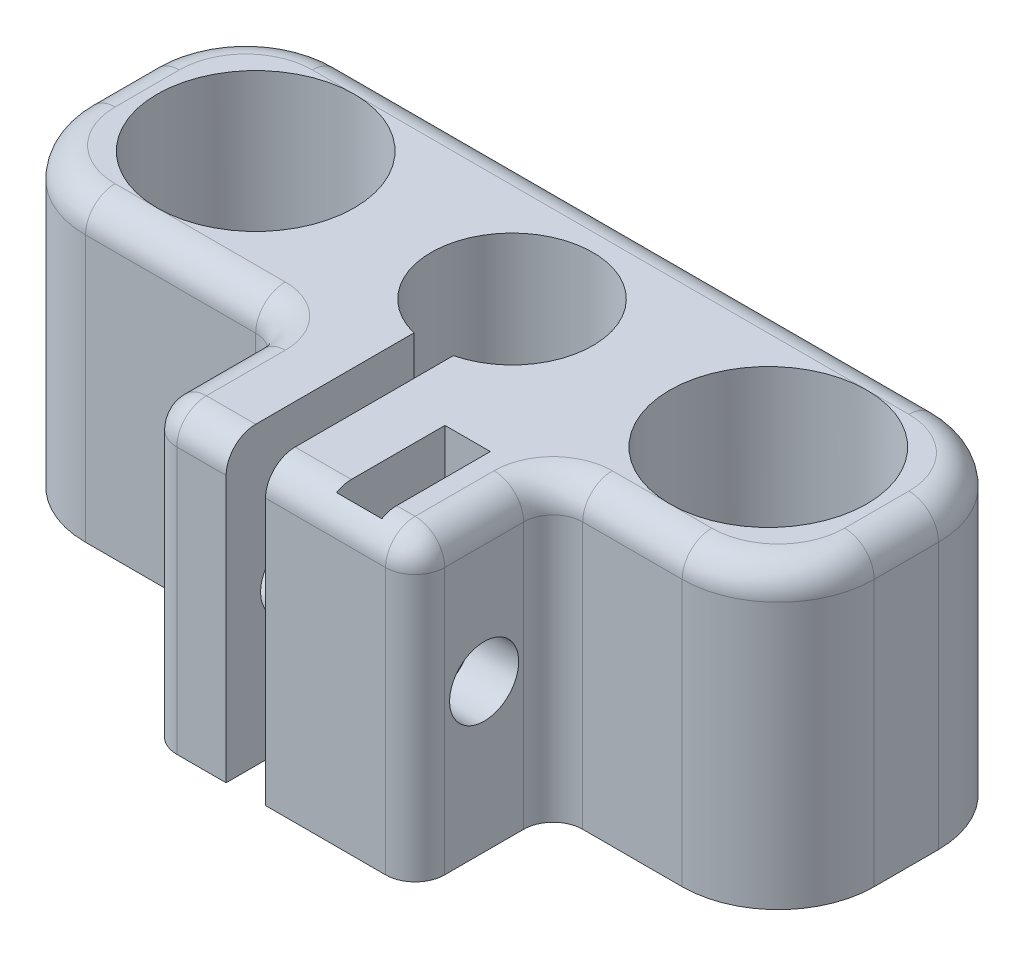
from build123d import *

# Parameters (mm, degrees)
SKETCH1_W               = 2.3
SKETCH1_H               = 5.5
SKETCH1_R               = 2.25
BOSS_EXTRUDE1_DEPTH     = 15
CUT_EXTRUDE1_DEPTH      = 33.128647653
CUT_EXTRUDE1_DEPTH_BACK = 33.128647653
SKETCH2_R               = 1.75
FILLET2_R               = 1.5
SKETCH4_R               = 5
CUT_EXTRUDE2_DEPTH      = 10


with BuildPart() as part:
    # Sketch1 → Boss-Extrude1 (new body)
    with BuildSketch(Plane(origin=(0, 0, 0), x_dir=(1, 0, 0), z_dir=(0, 1, 0))):
        with BuildLine():
            Line((15.13, 6.5), (-15.13, 6.5))
            ThreePointArc((-15.13, 6.5), (-18.573610024, 5.073610024), (-20, 1.63))
            Line((-20, 1.63), (-20, -1.63))
            ThreePointArc((-20, -1.63), (-18.573610024, -5.073610024), (-15.13, -6.5))
            Line((-15.13, -6.5), (-6.5, -6.5))
            ThreePointArc((-6.5, -6.5), (-5.439339828, -6.939339828), (-5, -8))
            Line((-5, -8), (-5, -12))
            ThreePointArc((-5, -12), (-4.560660172, -13.060660172), (-3.5, -13.5))
            Line((-3.5, -13.5), (-1, -13.5))
            Line((-1, -13.5), (-1, -3.97617907))
            ThreePointArc((-1, -3.97617907), (-2.520912533, 3.233419243), (4.1, 0))
            ThreePointArc((4.1, 0), (3.233419243, -2.520912533), (1, -3.97617907))
            Line((1, -3.97617907), (1, -13.5))
            Line((1, -13.5), (5.587465673, -13.5))
            Line((5.587465673, -13.5), (7.087465673, -13.5))
            ThreePointArc((7.087465673, -13.5), (8.148125845, -13.060660172), (8.587465673, -12))
            Line((8.587465673, -12), (8.587465673, -8))
            ThreePointArc((8.587465673, -8), (9.026805501, -6.939339828), (10.087465673, -6.5))
            Line((10.087465673, -6.5), (15.13, -6.5))
            ThreePointArc((15.13, -6.5), (18.573610024, -5.073610024), (20, -1.63))
            Line((20, -1.63), (20, 1.63))
            ThreePointArc((20, 1.63), (18.573610024, 5.073610024), (15.13, 6.5))
        make_face()
        with Locations((5, -10)):
            Rectangle(SKETCH1_W, SKETCH1_H, mode=Mode.SUBTRACT)
        with Locations(Location((-13, 0, 0), (0, 0, 270))):
            Circle(SKETCH1_R, mode=Mode.SUBTRACT)
        with Locations(Location((13, 0, 0), (0, 0, 270))):
            Circle(SKETCH1_R, mode=Mode.SUBTRACT)
    extrude(amount=BOSS_EXTRUDE1_DEPTH)

    # Sketch2 → Cut-Extrude1 (cut, two sides: drawn at the far end of the back side and taken through both)
    with BuildSketch(Plane(origin=(5, 0, 0), x_dir=(0, 0, -1), z_dir=(1, 0, 0)).offset(-CUT_EXTRUDE1_DEPTH_BACK)):
        with Locations((-10, 7.5)):
            Circle(SKETCH2_R)
    extrude(amount=CUT_EXTRUDE1_DEPTH + CUT_EXTRUDE1_DEPTH_BACK, mode=Mode.SUBTRACT)

    # Fillet2
    # the kernel refuses this fillet: 1.5 mm, written as the material it takes off along each edge
    with BuildSketch(Plane(origin=(7.087465673, 15, 13.5), x_dir=(0, 0, -1), z_dir=(-1, 0, 0))) as fillet2_piece_1:
        with BuildLine():
            CenterArc((FILLET2_R, FILLET2_R), FILLET2_R, 180, 90)
            Line((0, FILLET2_R), (0, 0))
            Line((0, 0), (FILLET2_R, 0))
        make_face()
    extrude(amount=9.837465673, mode=Mode.SUBTRACT)
    with BuildSketch(Plane(origin=(10.087465673, 15, 6.5), x_dir=(0, 0, -1), z_dir=(1, 0, 0))) as fillet2_piece_2:
        with BuildLine():
            CenterArc((FILLET2_R, -FILLET2_R), FILLET2_R, 90, 90)
            Line((0, -FILLET2_R), (0, 0))
            Line((0, 0), (FILLET2_R, 0))
        make_face()
    extrude(amount=5.042534327, mode=Mode.SUBTRACT)
    with BuildSketch(Plane(origin=(15.13, 15, 1.63), x_dir=(0, 0, 1), z_dir=(-1, 0, 0))) as fillet2_piece_3:
        with BuildLine():
            CenterArc((4.87 - FILLET2_R, -FILLET2_R), FILLET2_R, 0, 90)
            Line((4.87, -FILLET2_R), (4.87, 0))
            Line((4.87, 0), (4.87 - FILLET2_R, 0))
        make_face()
    revolve(axis=Axis((15.13, 15, 1.63), (0, 1, 0)), revolution_arc=90, mode=Mode.SUBTRACT)
    with BuildSketch(Plane(origin=(20, 15, 1.63), x_dir=(-1, 0, 0), z_dir=(0, 0, -1)), Plane(origin=(-20, 15, -1.63), x_dir=(1, 0, 0), z_dir=(0, 0, 1))) as fillet2_piece_4:
        with BuildLine():
            CenterArc((FILLET2_R, -FILLET2_R), FILLET2_R, 90, 90)
            Line((0, -FILLET2_R), (0, 0))
            Line((0, 0), (FILLET2_R, 0))
        make_face()
    extrude(amount=3.26, mode=Mode.SUBTRACT)
    with BuildSketch(Plane(origin=(15.13, 15, -1.63), x_dir=(1, 0, 0), z_dir=(0, 0, 1))) as fillet2_piece_5:
        with BuildLine():
            CenterArc((4.87 - FILLET2_R, -FILLET2_R), FILLET2_R, 0, 90)
            Line((4.87, -FILLET2_R), (4.87, 0))
            Line((4.87, 0), (4.87 - FILLET2_R, 0))
        make_face()
    revolve(axis=Axis((15.13, 15, -1.63), (0, 1, 0)), revolution_arc=90, mode=Mode.SUBTRACT)
    with BuildSketch(Plane(origin=(15.13, 15, -6.5), x_dir=(0, 0, 1), z_dir=(-1, 0, 0))) as fillet2_piece_6:
        with BuildLine():
            CenterArc((FILLET2_R, -FILLET2_R), FILLET2_R, 90, 90)
            Line((0, -FILLET2_R), (0, 0))
            Line((0, 0), (FILLET2_R, 0))
        make_face()
    extrude(amount=30.26, mode=Mode.SUBTRACT)
    with BuildSketch(Plane(origin=(-15.13, 15, -1.63), x_dir=(0, 0, -1), z_dir=(1, 0, 0))) as fillet2_piece_7:
        with BuildLine():
            CenterArc((4.87 - FILLET2_R, -FILLET2_R), FILLET2_R, 0, 90)
            Line((4.87, -FILLET2_R), (4.87, 0))
            Line((4.87, 0), (4.87 - FILLET2_R, 0))
        make_face()
    revolve(axis=Axis((-15.13, 15, -1.63), (0, 1, 0)), revolution_arc=90, mode=Mode.SUBTRACT)
    with BuildSketch(Plane(origin=(-3.5, 15, 13.5), x_dir=(0, 0, -1), z_dir=(1, 0, 0))) as fillet2_piece_8:
        with BuildLine():
            CenterArc((FILLET2_R, -FILLET2_R), FILLET2_R, 90, 90)
            Line((0, -FILLET2_R), (0, 0))
            Line((0, 0), (FILLET2_R, 0))
        make_face()
    extrude(amount=6.25, mode=Mode.SUBTRACT)
    with BuildSketch(Plane(origin=(-3.5, 15, 12), x_dir=(-1, 0, 0), z_dir=(0, 0, -1))) as fillet2_piece_9:
        with BuildLine():
            CenterArc((1.5 - FILLET2_R, -FILLET2_R), FILLET2_R, 0, 90)
            Line((1.5, -FILLET2_R), (1.5, 0))
            Line((1.5, 0), (1.5 - FILLET2_R, 0))
        make_face()
    revolve(axis=Axis((-3.5, 15, 12), (0, 1, 0)), revolution_arc=90, mode=Mode.SUBTRACT)
    with BuildSketch(Plane(origin=(-5, 15, 8), x_dir=(1, 0, 0), z_dir=(0, 0, 1)), Plane(origin=(8.587465673, 15, 12), x_dir=(-1, 0, 0), z_dir=(0, 0, -1))) as fillet2_piece_10:
        with BuildLine():
            CenterArc((FILLET2_R, -FILLET2_R), FILLET2_R, 90, 90)
            Line((0, -FILLET2_R), (0, 0))
            Line((0, 0), (FILLET2_R, 0))
        make_face()
    extrude(amount=4, mode=Mode.SUBTRACT)
    with BuildSketch(Plane(origin=(-6.5, 15, 8), x_dir=(0, 0, -1), z_dir=(-1, 0, 0))) as fillet2_piece_11:
        with BuildLine():
            CenterArc((1.5 + FILLET2_R, FILLET2_R), FILLET2_R, 180, 90)
            Line((1.5, FILLET2_R), (1.5, 0))
            Line((1.5, 0), (1.5 + FILLET2_R, 0))
        make_face()
    revolve(axis=Axis((-6.5, 15, 8), (0, -1, 0)), revolution_arc=90, mode=Mode.SUBTRACT)
    with BuildSketch(Plane(origin=(-15.13, 15, 1.63), x_dir=(-1, 0, 0), z_dir=(0, 0, -1))) as fillet2_piece_12:
        with BuildLine():
            CenterArc((4.87 - FILLET2_R, -FILLET2_R), FILLET2_R, 0, 90)
            Line((4.87, -FILLET2_R), (4.87, 0))
            Line((4.87, 0), (4.87 - FILLET2_R, 0))
        make_face()
    revolve(axis=Axis((-15.13, 15, 1.63), (0, 1, 0)), revolution_arc=90, mode=Mode.SUBTRACT)
    with BuildSketch(Plane(origin=(-15.13, 15, 6.5), x_dir=(0, 0, -1), z_dir=(1, 0, 0))) as fillet2_piece_13:
        with BuildLine():
            CenterArc((FILLET2_R, -FILLET2_R), FILLET2_R, 90, 90)
            Line((0, -FILLET2_R), (0, 0))
            Line((0, 0), (FILLET2_R, 0))
        make_face()
    extrude(amount=8.63, mode=Mode.SUBTRACT)
    with BuildSketch(Plane(origin=(7.087465673, 15, 12), x_dir=(0, 0, 1), z_dir=(-1, 0, 0))) as fillet2_piece_14:
        with BuildLine():
            CenterArc((1.5 - FILLET2_R, -FILLET2_R), FILLET2_R, 0, 90)
            Line((1.5, -FILLET2_R), (1.5, 0))
            Line((1.5, 0), (1.5 - FILLET2_R, 0))
        make_face()
    revolve(axis=Axis((7.087465673, 15, 12), (0, 1, 0)), revolution_arc=90, mode=Mode.SUBTRACT)
    with BuildSketch(Plane(origin=(10.087465673, 15, 8), x_dir=(-1, 0, 0), z_dir=(0, 0, 1))) as fillet2_piece_15:
        with BuildLine():
            CenterArc((1.5 + FILLET2_R, FILLET2_R), FILLET2_R, 180, 90)
            Line((1.5, FILLET2_R), (1.5, 0))
            Line((1.5, 0), (1.5 + FILLET2_R, 0))
        make_face()
    revolve(axis=Axis((10.087465673, 15, 8), (0, -1, 0)), revolution_arc=90, mode=Mode.SUBTRACT)

    # Sketch4 → Cut-Extrude2 (cut)
    with BuildSketch(Plane(origin=(0, 15, 0), x_dir=(1, 0, 0), z_dir=(0, 1, 0))):
        with Locations(Location((-13, 0, 0), (0, 0, 270))):
            Circle(SKETCH4_R)
        with Locations(Location((13, 0, 0), (0, 0, 270))):
            Circle(SKETCH4_R)
    extrude(amount=-CUT_EXTRUDE2_DEPTH, mode=Mode.SUBTRACT)


solid = part.part
